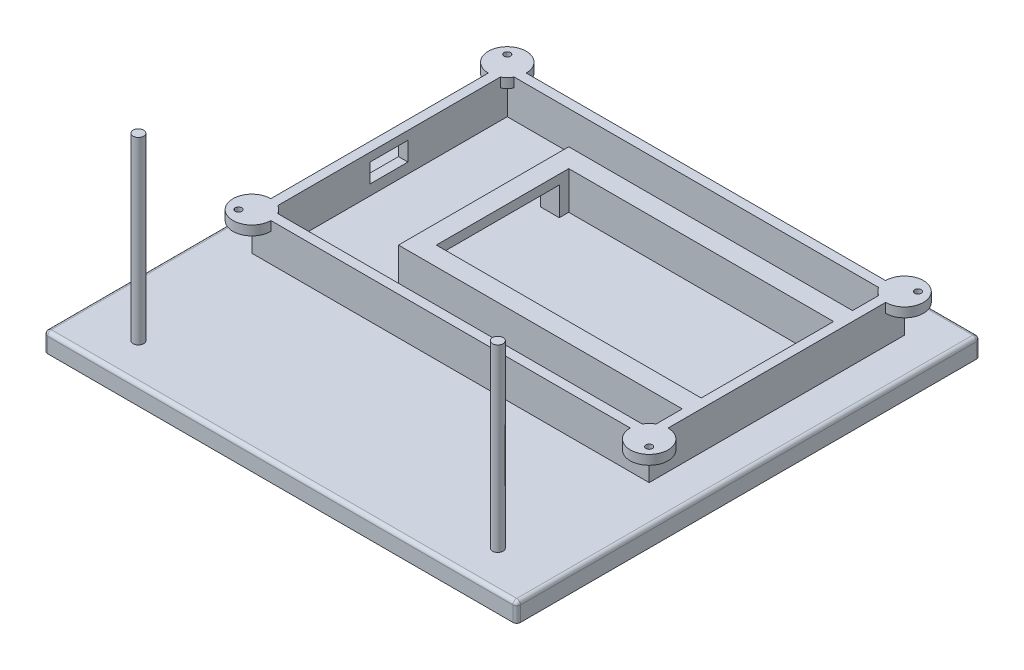
from build123d import *

# Parameters (mm, degrees)
SKETCH1_W           = 200
SKETCH1_H           = 125
BOSS_EXTRUDE3_DEPTH = 40
BOSS_EXTRUDE4_DEPTH = 10
EXTRUDE_THIN1_DEPTH = 40
SKETCH5_W           = 60
SKETCH5_H           = 15
CUT_EXTRUDE2_DEPTH  = 40
SKETCH6_W           = 210
SKETCH6_H           = 135
CUT_EXTRUDE3_DEPTH  = 20
SKETCH7_R           = 10
BOSS_EXTRUDE5_DEPTH = 5
SKETCH8_R           = 1.7
CUT_EXTRUDE5_DEPTH  = 5
SKETCH9_W           = 20
SKETCH9_H           = 10
CUT_EXTRUDE6_DEPTH  = 10
SKETCH10_W          = 230
SKETCH10_H          = 155
BOSS_EXTRUDE6_DEPTH = 10
SKETCH14_R          = 2.8
BOSS_EXTRUDE7_DEPTH = 95
FILLET1_R           = 2


with BuildPart() as part:
    # Sketch1 → Boss-Extrude3 (new body)
    with BuildSketch(Plane(origin=(0, 0, 0), x_dir=(1, 0, 0), z_dir=(0, 1, 0))):
        Polygon((5, 0), (0, 0), (0, -135), (210, -135), (210, 0), align=None)
        with Locations((105, -67.5)):
            Rectangle(SKETCH1_W, SKETCH1_H, mode=Mode.SUBTRACT)
    extrude(amount=BOSS_EXTRUDE3_DEPTH)

    # Sketch3 → Boss-Extrude4 (add)
    with BuildSketch(Plane(origin=(0, 0, 0), x_dir=(-1, 0, 0), z_dir=(0, -1, 0))):
        Polygon((-220, -145), (0, -145), (10, -145), (10, 10), (-220, 10), align=None)
    extrude(amount=BOSS_EXTRUDE4_DEPTH)

    # Sketch4 → Extrude-Thin1 (add)
    with BuildSketch(Plane(origin=(0, 0, 0), x_dir=(1, 0, 0), z_dir=(0, 1, 0))):
        Polygon((205, -32.5), (65, -32.5), (65, -102.5), (205, -102.5), (205, -112.5), (55, -112.5), (55, -22.5), (205, -22.5), align=None)
    extrude(amount=EXTRUDE_THIN1_DEPTH)

    # Sketch5 → Cut-Extrude2 (cut)
    with BuildSketch(Plane.ZY.offset(-55)):
        with Locations((67.5, 7.5)):
            Rectangle(SKETCH5_W, SKETCH5_H)
    extrude(amount=-CUT_EXTRUDE2_DEPTH, mode=Mode.SUBTRACT)

    # Sketch6 → Cut-Extrude3 (cut)
    with BuildSketch(Plane(origin=(0, 40, 0), x_dir=(1, 0, 0), z_dir=(0, 1, 0))):
        with Locations((105, -67.5)):
            Rectangle(SKETCH6_W, SKETCH6_H)
    extrude(amount=-CUT_EXTRUDE3_DEPTH, mode=Mode.SUBTRACT)

    # Sketch7 → Boss-Extrude5 (add)
    with BuildSketch(Plane(origin=(0, 20, 0), x_dir=(1, 0, 0), z_dir=(0, 1, 0))):
        Circle(SKETCH7_R)
        with Locations((210, 0)):
            Circle(SKETCH7_R)
        with Locations((210, -135)):
            Circle(SKETCH7_R)
        with Locations((0, -135)):
            Circle(SKETCH7_R)
    extrude(amount=-BOSS_EXTRUDE5_DEPTH)

    # Sketch8 → Cut-Extrude5 (cut)
    with BuildSketch(Plane(origin=(0, 20, 0), x_dir=(1, 0, 0), z_dir=(0, 1, 0))):
        with Locations((-3.535533906, 3.535533906)):
            Circle(SKETCH8_R)
        with Locations((213.535533906, 3.535533906)):
            Circle(SKETCH8_R)
        with Locations((213.535533906, -138.535533906)):
            Circle(SKETCH8_R)
        with Locations((-3.535533906, -138.535533906)):
            Circle(SKETCH8_R)
    extrude(amount=-CUT_EXTRUDE5_DEPTH, mode=Mode.SUBTRACT)

    # Sketch9 → Cut-Extrude6 (cut)
    with BuildSketch(Plane.ZY):
        with Locations((67.5, 10.5)):
            Rectangle(SKETCH9_W, SKETCH9_H)
    extrude(amount=-CUT_EXTRUDE6_DEPTH, mode=Mode.SUBTRACT)

    # Sketch10 → Boss-Extrude6 (add)
    with BuildSketch(Plane(origin=(0, 0, 0), x_dir=(1, 0, 0), z_dir=(0, 1, 0))):
        Polygon((230, 20), (-10, 20), (-20, 20), (-20, -225), (230, -225), align=None)
        with Locations((105, -67.5)):
            Rectangle(SKETCH10_W, SKETCH10_H, mode=Mode.SUBTRACT)
    extrude(amount=-BOSS_EXTRUDE6_DEPTH)

    # Sketch14 → Boss-Extrude7 (add)
    with BuildSketch(Plane(origin=(0, 0, 0), x_dir=(1, 0, 0), z_dir=(0, 1, 0))):
        with Locations((10, -205)):
            Circle(SKETCH14_R)
        with Locations((200, -205)):
            Circle(SKETCH14_R)
    extrude(amount=BOSS_EXTRUDE7_DEPTH)

    # Fillet1
    fillet1_edges = [part.edges().sort_by_distance(p)[0] for p in [
        (-20, -5, -20),
        (-20, -5, 225),
        (230, -5, 225),
        (230, -5, -20),
        (105, 0, -20),
        (230, 0, 102.5),
        (-20, 0, 102.5),
        (105, 0, 225),
    ]]
    fillet(fillet1_edges, radius=FILLET1_R)


solid = part.part
